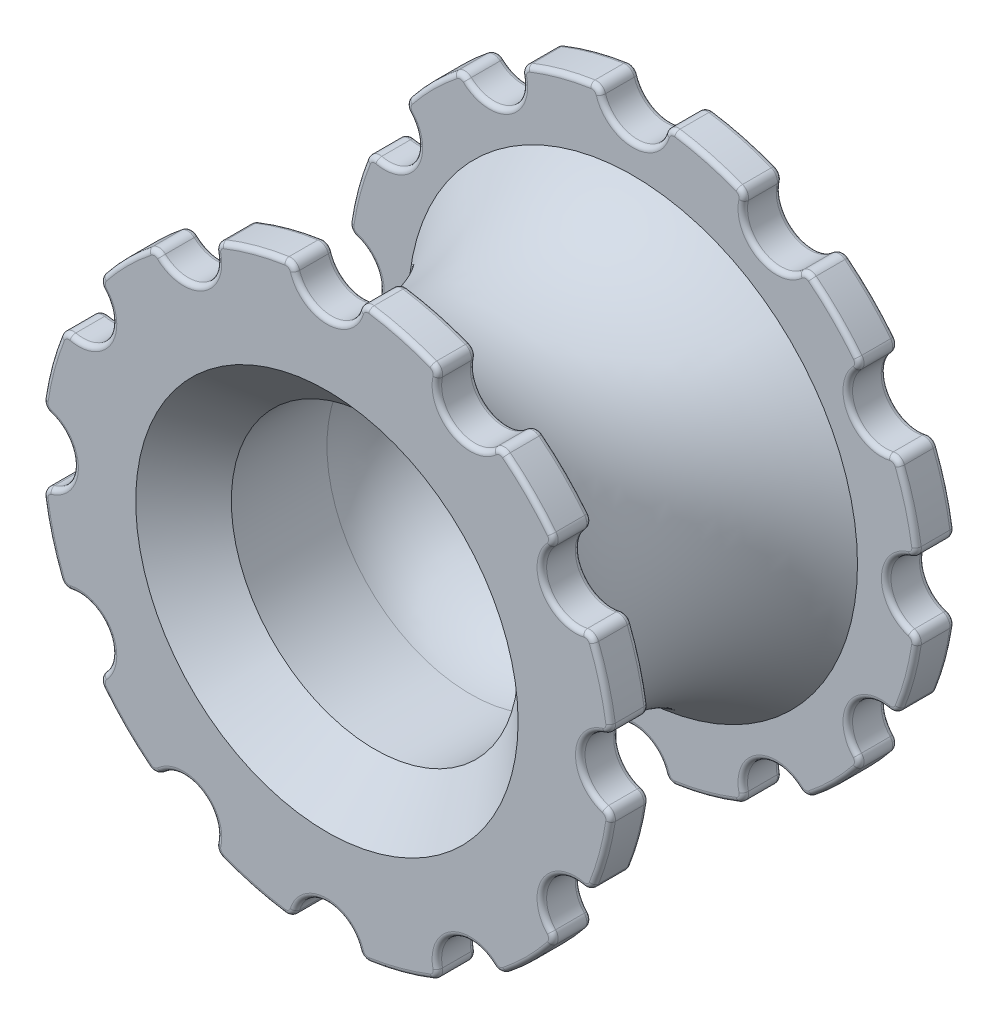
from build123d import *

# Parameters (mm, degrees)
EXTRUDE_1_DEPTH     = 36
FILLET_1_R          = 1
SKETCH_3_R          = 15
CUT_EXTRUDE_1_DEPTH = 25
FILLET_2_R          = 0.5
FILLET_3_R          = 10
CHAMFER_1_SIZE      = 5
SKETCH_4_R          = 6
EXTRUDE_2_DEPTH     = 1.5
SKETCH_5_R          = 3.75
EXTRUDE_3_DEPTH     = 3.5
SKETCH_6_R          = 2.7
CUT_EXTRUDE_2_DEPTH = 1
CUT_EXTRUDE_3_DEPTH = 8
SKETCH_8_R          = 1.475
CUT_EXTRUDE_4_DEPTH = 17


with BuildPart() as part:
    # Эскиз1 → Бобышка-Вытянуть1 (new body)
    with BuildSketch(Plane.XY):
        with BuildLine():
            ThreePointArc((-3.494040064, 29.795833333), (0, 26.5), (3.494040064, 29.795833333))
            ThreePointArc((3.494040064, 29.795833333), (7.764571353, 28.977774789), (11.871989209, 27.550968626))
            ThreePointArc((11.871989209, 27.550968626), (13.25, 22.9496732), (17.923844124, 24.056928561))
            ThreePointArc((17.923844124, 24.056928561), (21.213203436, 21.213203436), (24.056928561, 17.923844124))
            ThreePointArc((24.056928561, 17.923844124), (22.9496732, 13.25), (27.550968626, 11.871989209))
            ThreePointArc((27.550968626, 11.871989209), (28.977774789, 7.764571353), (29.795833333, 3.494040064))
            ThreePointArc((29.795833333, 3.494040064), (26.5, 0), (29.795833333, -3.494040064))
            ThreePointArc((29.795833333, -3.494040064), (28.977774789, -7.764571353), (27.550968626, -11.871989209))
            ThreePointArc((27.550968626, -11.871989209), (22.9496732, -13.25), (24.056928561, -17.923844124))
            ThreePointArc((24.056928561, -17.923844124), (21.213203436, -21.213203436), (17.923844124, -24.056928561))
            ThreePointArc((17.923844124, -24.056928561), (13.25, -22.9496732), (11.871989209, -27.550968626))
            ThreePointArc((11.871989209, -27.550968626), (7.764571353, -28.977774789), (3.494040064, -29.795833333))
            ThreePointArc((3.494040064, -29.795833333), (0, -26.5), (-3.494040064, -29.795833333))
            ThreePointArc((-3.494040064, -29.795833333), (-7.764571353, -28.977774789), (-11.871989209, -27.550968626))
            ThreePointArc((-11.871989209, -27.550968626), (-13.25, -22.9496732), (-17.923844124, -24.056928561))
            ThreePointArc((-17.923844124, -24.056928561), (-21.213203436, -21.213203436), (-24.056928561, -17.923844124))
            ThreePointArc((-24.056928561, -17.923844124), (-22.9496732, -13.25), (-27.550968626, -11.871989209))
            ThreePointArc((-27.550968626, -11.871989209), (-28.977774789, -7.764571353), (-29.795833333, -3.494040064))
            ThreePointArc((-29.795833333, -3.494040064), (-26.5, 0), (-29.795833333, 3.494040064))
            ThreePointArc((-29.795833333, 3.494040064), (-28.977774789, 7.764571353), (-27.550968626, 11.871989209))
            ThreePointArc((-27.550968626, 11.871989209), (-22.9496732, 13.25), (-24.056928561, 17.923844124))
            ThreePointArc((-24.056928561, 17.923844124), (-21.213203436, 21.213203436), (-17.923844124, 24.056928561))
            ThreePointArc((-17.923844124, 24.056928561), (-13.25, 22.9496732), (-11.871989209, 27.550968626))
            ThreePointArc((-11.871989209, 27.550968626), (-7.764571353, 28.977774789), (-3.494040064, 29.795833333))
        make_face()
    extrude(amount=EXTRUDE_1_DEPTH)

    # Скругление1
    fillet_1_edges = [part.edges().sort_by_distance(p)[0] for p in [
        (3.494040064, 29.795833333, 18),
        (11.871989209, 27.550968626, 18),
        (17.923844124, 24.056928561, 18),
        (29.795833333, 3.494040064, 18),
        (27.550968626, 11.871989209, 18),
        (24.056928561, 17.923844124, 18),
        (29.795833333, -3.494040064, 18),
        (27.550968626, -11.871989209, 18),
        (17.923844124, -24.056928561, 18),
        (24.056928561, -17.923844124, 18),
        (11.871989209, -27.550968626, 18),
        (-11.871989209, -27.550968626, 18),
        (3.494040064, -29.795833333, 18),
        (-3.494040064, -29.795833333, 18),
        (-17.923844124, -24.056928561, 18),
        (-24.056928561, -17.923844124, 18),
        (-27.550968626, -11.871989209, 18),
        (-29.795833333, -3.494040064, 18),
        (-29.795833333, 3.494040064, 18),
        (-27.550968626, 11.871989209, 18),
        (-24.056928561, 17.923844124, 18),
        (-17.923844124, 24.056928561, 18),
        (-11.871989209, 27.550968626, 18),
        (-3.494040064, 29.795833333, 18),
    ]]
    fillet(fillet_1_edges, radius=FILLET_1_R)

    # Эскиз2 → Вырез-Повернуть1 (revolve, cut)
    with BuildSketch(Plane(origin=(0, 0, 0), x_dir=(1, 0, 0), z_dir=(0, 1, 0))):
        with BuildLine():
            Line((-30, -4), (-30, -32))
            Line((-30, -32), (-23.5, -32))
            ThreePointArc((-23.5, -32), (-17.782856857, -18), (-23.5, -4))
            Line((-23.5, -4), (-30, -4))
        make_face()
    revolve(axis=Axis((0, 0, 1000), (0, 0, -1)), mode=Mode.SUBTRACT)

    # Эскиз3 → Вырез-Вытянуть1 (cut)
    with BuildSketch(Plane.XY.offset(36)):
        Circle(SKETCH_3_R)
    extrude(amount=-CUT_EXTRUDE_1_DEPTH, mode=Mode.SUBTRACT)

    # Скругление2
    fillet_2_edges = [part.edges().sort_by_distance(p)[0] for p in [
        (-29.525356682, -3.768908965, 4),
        (-26.5, 0, 4),
        (-29.525356682, 3.768908965, 4),
        (-28.977774789, 7.764571353, 4),
        (-27.454163425, 11.498707433, 4),
        (-22.9496732, 13.25, 4),
        (-23.68525446, 18.02664925, 4),
        (-21.213203436, 21.213203436, 4),
        (-18.02664925, 23.68525446, 4),
        (-13.25, 22.9496732, 4),
        (-11.498707433, 27.454163425, 4),
        (-7.764571353, 28.977774789, 4),
        (-3.768908965, 29.525356682, 4),
        (0, 26.5, 4),
        (3.768908965, 29.525356682, 4),
        (7.764571353, 28.977774789, 4),
        (11.498707433, 27.454163425, 4),
        (13.25, 22.9496732, 4),
        (18.02664925, 23.68525446, 4),
        (21.213203436, 21.213203436, 4),
        (23.68525446, 18.02664925, 4),
        (22.9496732, 13.25, 4),
        (27.454163425, 11.498707433, 4),
        (28.977774789, 7.764571353, 4),
        (29.525356682, 3.768908965, 4),
        (26.5, 0, 4),
        (29.525356682, -3.768908965, 4),
        (28.977774789, -7.764571353, 4),
        (27.454163425, -11.498707433, 4),
        (22.9496732, -13.25, 4),
        (23.68525446, -18.02664925, 4),
        (21.213203436, -21.213203436, 4),
        (18.02664925, -23.68525446, 4),
        (13.25, -22.9496732, 4),
        (11.498707433, -27.454163425, 4),
        (7.764571353, -28.977774789, 4),
        (3.768908965, -29.525356682, 4),
        (0, -26.5, 4),
        (-3.768908965, -29.525356682, 4),
        (-7.764571353, -28.977774789, 4),
        (-11.498707433, -27.454163425, 4),
        (-13.25, -22.9496732, 4),
        (-18.02664925, -23.68525446, 4),
        (-21.213203436, -21.213203436, 4),
        (-23.68525446, -18.02664925, 4),
        (-22.9496732, -13.25, 4),
        (-27.454163425, -11.498707433, 4),
        (-29.525356682, -3.768908965, 32),
        (-26.5, 0, 32),
        (-29.525356682, 3.768908965, 32),
        (-28.977774789, 7.764571353, 32),
        (-27.454163425, 11.498707433, 32),
        (-22.9496732, 13.25, 32),
        (-23.68525446, 18.02664925, 32),
        (-21.213203436, 21.213203436, 32),
        (-18.02664925, 23.68525446, 32),
        (-13.25, 22.9496732, 32),
        (-11.498707433, 27.454163425, 32),
        (-7.764571353, 28.977774789, 32),
        (-3.768908965, 29.525356682, 32),
        (0, 26.5, 32),
        (3.768908965, 29.525356682, 32),
        (7.764571353, 28.977774789, 32),
        (11.498707433, 27.454163425, 32),
        (13.25, 22.9496732, 32),
        (18.02664925, 23.68525446, 32),
        (21.213203436, 21.213203436, 32),
        (23.68525446, 18.02664925, 32),
        (22.9496732, 13.25, 32),
        (27.454163425, 11.498707433, 32),
        (28.977774789, 7.764571353, 32),
        (29.525356682, 3.768908965, 32),
        (26.5, 0, 32),
        (29.525356682, -3.768908965, 32),
        (28.977774789, -7.764571353, 32),
        (27.454163425, -11.498707433, 32),
        (22.9496732, -13.25, 32),
        (23.68525446, -18.02664925, 32),
        (21.213203436, -21.213203436, 32),
        (18.02664925, -23.68525446, 32),
        (13.25, -22.9496732, 32),
        (11.498707433, -27.454163425, 32),
        (7.764571353, -28.977774789, 32),
        (3.768908965, -29.525356682, 32),
        (0, -26.5, 32),
        (-3.768908965, -29.525356682, 32),
        (-7.764571353, -28.977774789, 32),
        (-11.498707433, -27.454163425, 32),
        (-13.25, -22.9496732, 32),
        (-18.02664925, -23.68525446, 32),
        (-21.213203436, -21.213203436, 32),
        (-23.68525446, -18.02664925, 32),
        (-22.9496732, -13.25, 32),
        (-27.454163425, -11.498707433, 32),
        (-29.525356682, 3.768908965, 36),
        (-28.977774789, 7.764571353, 36),
        (-27.454163425, 11.498707433, 36),
        (-22.9496732, 13.25, 36),
        (-23.68525446, 18.02664925, 36),
        (-21.213203436, 21.213203436, 36),
        (-18.02664925, 23.68525446, 36),
        (-13.25, 22.9496732, 36),
        (-11.498707433, 27.454163425, 36),
        (-7.764571353, 28.977774789, 36),
        (-3.768908965, 29.525356682, 36),
        (0, 26.5, 36),
        (3.768908965, 29.525356682, 36),
        (7.764571353, 28.977774789, 36),
        (11.498707433, 27.454163425, 36),
        (13.25, 22.9496732, 36),
        (18.02664925, 23.68525446, 36),
        (21.213203436, 21.213203436, 36),
        (23.68525446, 18.02664925, 36),
        (22.9496732, 13.25, 36),
        (27.454163425, 11.498707433, 36),
        (28.977774789, 7.764571353, 36),
        (29.525356682, 3.768908965, 36),
        (26.5, 0, 36),
        (29.525356682, -3.768908965, 36),
        (28.977774789, -7.764571353, 36),
        (27.454163425, -11.498707433, 36),
        (22.9496732, -13.25, 36),
        (23.68525446, -18.02664925, 36),
        (21.213203436, -21.213203436, 36),
        (18.02664925, -23.68525446, 36),
        (13.25, -22.9496732, 36),
        (11.498707433, -27.454163425, 36),
        (7.764571353, -28.977774789, 36),
        (3.768908965, -29.525356682, 36),
        (0, -26.5, 36),
        (-3.768908965, -29.525356682, 36),
        (-7.764571353, -28.977774789, 36),
        (-11.498707433, -27.454163425, 36),
        (-13.25, -22.9496732, 36),
        (-18.02664925, -23.68525446, 36),
        (-21.213203436, -21.213203436, 36),
        (-23.68525446, -18.02664925, 36),
        (-22.9496732, -13.25, 36),
        (-27.454163425, -11.498707433, 36),
        (-28.977774789, -7.764571353, 36),
        (-29.525356682, -3.768908965, 36),
        (3.768908965, 29.525356682, 0),
        (0, 26.5, 0),
        (-3.768908965, 29.525356682, 0),
        (-7.764571353, 28.977774789, 0),
        (-11.498707433, 27.454163425, 0),
        (-13.25, 22.9496732, 0),
        (-18.02664925, 23.68525446, 0),
        (-21.213203436, 21.213203436, 0),
        (-23.68525446, 18.02664925, 0),
        (-22.9496732, 13.25, 0),
        (-27.454163425, 11.498707433, 0),
        (-28.977774789, 7.764571353, 0),
        (-29.525356682, 3.768908965, 0),
        (-26.5, 0, 0),
        (-29.525356682, -3.768908965, 0),
        (-28.977774789, -7.764571353, 0),
        (-27.454163425, -11.498707433, 0),
        (-22.9496732, -13.25, 0),
        (-23.68525446, -18.02664925, 0),
        (-21.213203436, -21.213203436, 0),
        (-18.02664925, -23.68525446, 0),
        (-13.25, -22.9496732, 0),
        (-11.498707433, -27.454163425, 0),
        (-7.764571353, -28.977774789, 0),
        (-3.768908965, -29.525356682, 0),
        (0, -26.5, 0),
        (3.768908965, -29.525356682, 0),
        (7.764571353, -28.977774789, 0),
        (11.498707433, -27.454163425, 0),
        (13.25, -22.9496732, 0),
        (18.02664925, -23.68525446, 0),
        (21.213203436, -21.213203436, 0),
        (23.68525446, -18.02664925, 0),
        (22.9496732, -13.25, 0),
        (27.454163425, -11.498707433, 0),
        (28.977774789, -7.764571353, 0),
        (29.525356682, -3.768908965, 0),
        (26.5, 0, 0),
        (29.525356682, 3.768908965, 0),
        (28.977774789, 7.764571353, 0),
        (27.454163425, 11.498707433, 0),
        (22.9496732, 13.25, 0),
        (23.68525446, 18.02664925, 0),
        (21.213203436, 21.213203436, 0),
        (18.02664925, 23.68525446, 0),
        (13.25, 22.9496732, 0),
        (11.498707433, 27.454163425, 0),
        (7.764571353, 28.977774789, 0),
        (-28.977774789, -7.764571353, 4),
        (-28.977774789, -7.764571353, 32),
        (-26.5, 0, 36),
    ]]
    fillet(fillet_2_edges, radius=FILLET_2_R)

    # Скругление3
    fillet_3_edges = [part.edges().sort_by_distance(p)[0] for p in [
        (-15, 0, 11),
    ]]
    fillet(fillet_3_edges, radius=FILLET_3_R)

    # Фаска1
    chamfer_1_edges = [part.edges().sort_by_distance(p)[0] for p in [
        (-15, 0, 36),
    ]]
    chamfer(chamfer_1_edges, length=CHAMFER_1_SIZE)

    # Эскиз4 → Бобышка-Вытянуть2 (add)
    with BuildSketch(Plane(origin=(0, 0, 0), x_dir=(-1, 0, 0), z_dir=(0, 0, -1))):
        Circle(SKETCH_4_R)
    extrude(amount=EXTRUDE_2_DEPTH)

    # Эскиз5 → Бобышка-Вытянуть3 (add)
    with BuildSketch(Plane(origin=(0, 0, -1.5), x_dir=(-1, 0, 0), z_dir=(0, 0, -1))):
        Circle(SKETCH_5_R)
    extrude(amount=EXTRUDE_3_DEPTH)

    # Эскиз6 → Вырез-Вытянуть2 (cut)
    with BuildSketch(Plane(origin=(0, 0, -5), x_dir=(-1, 0, 0), z_dir=(0, 0, -1))):
        Circle(SKETCH_6_R)
    extrude(amount=-CUT_EXTRUDE_2_DEPTH, mode=Mode.SUBTRACT)

    # Эскиз7 → Вырез-Вытянуть3 (cut)
    with BuildSketch(Plane(origin=(0, 0, -4), x_dir=(-1, 0, 0), z_dir=(0, 0, -1))):
        with BuildLine():
            Line((-1.85, 1.966596044), (-1.85, -1.966596044))
            ThreePointArc((-1.85, -1.966596044), (0, -2.7), (1.85, -1.966596044))
            Line((1.85, -1.966596044), (1.85, 1.966596044))
            ThreePointArc((1.85, 1.966596044), (0, 2.7), (-1.85, 1.966596044))
        make_face()
    extrude(amount=-CUT_EXTRUDE_3_DEPTH, mode=Mode.SUBTRACT)

    # Эскиз8 → Вырез-Вытянуть4 (cut)
    with BuildSketch(Plane.XY.offset(11)):
        Circle(SKETCH_8_R)
    extrude(amount=-CUT_EXTRUDE_4_DEPTH, mode=Mode.SUBTRACT)


solid = part.part
